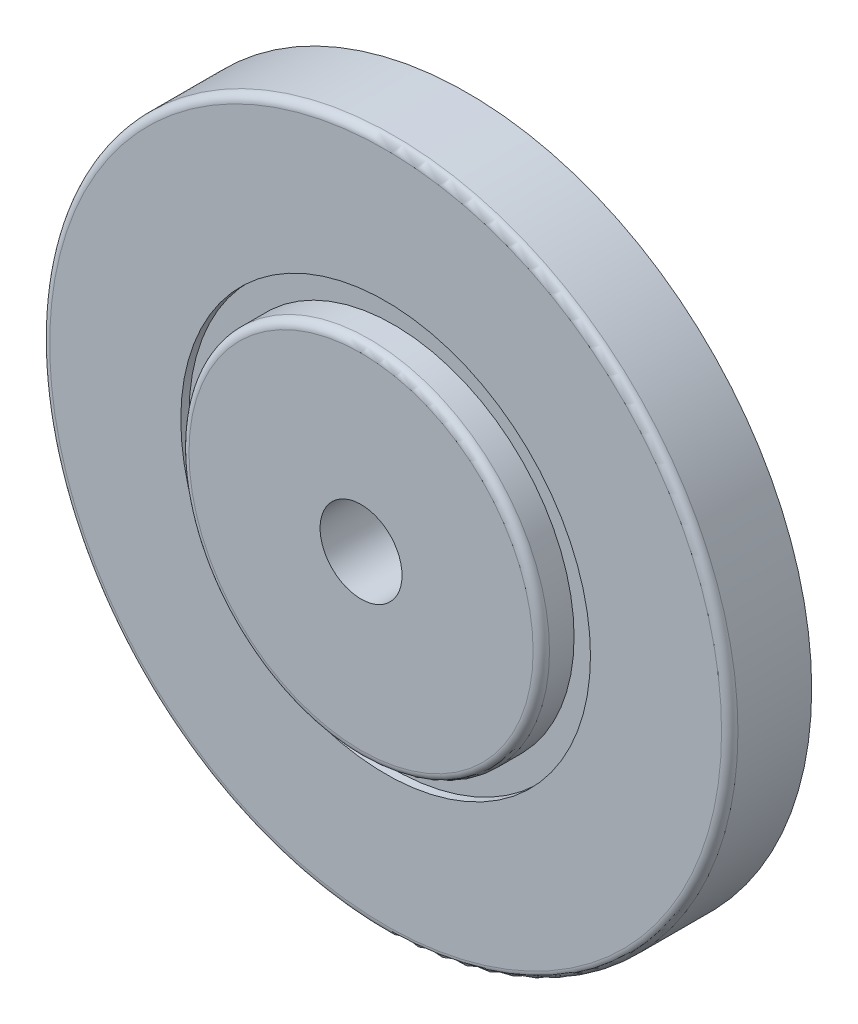
from build123d import *

# Parameters (mm, degrees)
CROQUIS1_R              = 21
SALIENTE_EXTRUIR1_DEPTH = 5
CROQUIS2_R              = 12.5
CORTAR_EXTRUIR1_DEPTH   = 0.5
CROQUIS3_R              = 11
SALIENTE_EXTRUIR2_DEPTH = 2
CROQUIS4_R              = 2.5
CORTAR_EXTRUIR2_DEPTH   = 31.401480227
REDONDEO1_R             = 0.5
REDONDEO2_R             = 0.5


with BuildPart() as part:
    # Croquis1 → Saliente-Extruir1 (new body)
    with BuildSketch(Plane.XY):
        Circle(CROQUIS1_R)
    extrude(amount=SALIENTE_EXTRUIR1_DEPTH)

    # Croquis2 → Cortar-Extruir1 (cut)
    with BuildSketch(Plane.XY.offset(5)):
        Circle(CROQUIS2_R)
    extrude(amount=-CORTAR_EXTRUIR1_DEPTH, mode=Mode.SUBTRACT)

    # Croquis3 → Saliente-Extruir2 (add)
    with BuildSketch(Plane.XY.offset(4.5)):
        Circle(CROQUIS3_R)
    extrude(amount=SALIENTE_EXTRUIR2_DEPTH)

    # Croquis4 → Cortar-Extruir2 (cut, through all)
    with BuildSketch(Plane.XY.offset(6.5)):
        Circle(CROQUIS4_R)
    extrude(amount=-CORTAR_EXTRUIR2_DEPTH, mode=Mode.SUBTRACT)

    # Redondeo1
    redondeo1_edges = [part.edges().sort_by_distance(p)[0] for p in [
        (-21, 0, 5),
    ]]
    fillet(redondeo1_edges, radius=REDONDEO1_R)

    # Redondeo2
    redondeo2_edges = [part.edges().sort_by_distance(p)[0] for p in [
        (-11, 0, 6.5),
    ]]
    fillet(redondeo2_edges, radius=REDONDEO2_R)


solid = part.part
